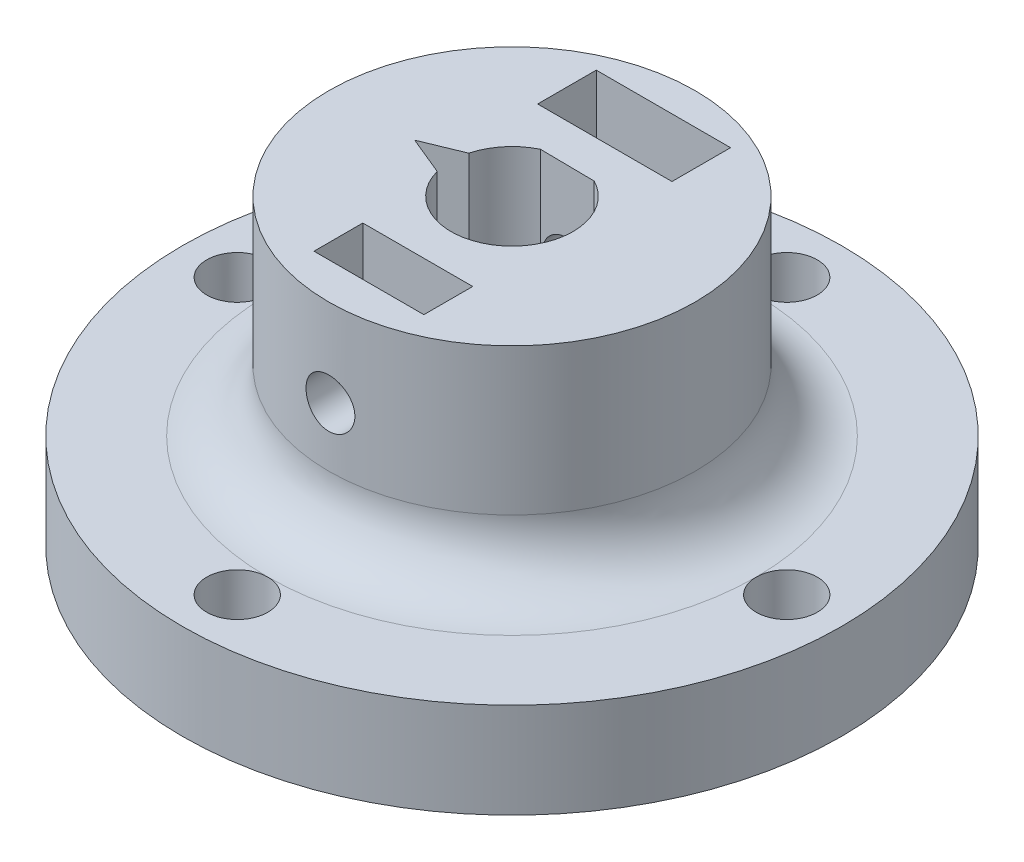
from build123d import *

# Parameters (mm, degrees)
SKETCH1_R               = 13.5
SKETCH1_R_2             = 1.25
BOSS_EXTRUDE2_DEPTH     = 2
SKETCH2_R               = 7.5
BOSS_EXTRUDE3_DEPTH     = 8.5
SKETCH4_R               = 2.5
CUT_EXTRUDE1_DEPTH      = 7.5
BOSS_EXTRUDE6_DEPTH     = 7.5
CUT_EXTRUDE2_DEPTH      = 7.5
CUT_EXTRUDE2_DEPTH_BACK = 11.75
SKETCH5_R               = 1
BOSS_EXTRUDE5_START     = 1.9
SKETCH7_R               = 13.5
SKETCH7_R_2             = 5.25
BOSS_EXTRUDE5_DEPTH     = 1.9
CUT_EXTRUDE3_DEPTH      = 8
FILLET1_R               = 2.5
SKETCH12_R              = 0.00537481
SKETCH12_R_2            = 0.008144056
SKETCH12_R_3            = 1.25
SKETCH12_R_4            = 0.012822725
CUT_EXTRUDE4_DEPTH      = 10
CIRPATTERN1_COUNT       = 4
SKETCH13_W              = 5.5
SKETCH13_H              = 2.4
SKETCH13_W_2            = 4.5
SKETCH13_H_2            = 2
CUT_EXTRUDE5_DEPTH      = 4
CUT_EXTRUDE6_DEPTH      = 2.4
CUT_EXTRUDE7_DEPTH      = 2


with BuildPart() as part:
    # Sketch1 → Boss-Extrude2 (new body)
    with BuildSketch(Plane(origin=(0, 0, 0), x_dir=(1, 0, 0), z_dir=(0, 1, 0))):
        with Locations(Location((0, 0, 0), (0, 0, 270))):
            Circle(SKETCH1_R)
        with Locations(Location((11.25, 0, 0), (0, 0, 270))):
            Circle(SKETCH1_R_2, mode=Mode.SUBTRACT)
        with Locations(Location((0, -11.25, 0), (0, 0, 270))):
            Circle(SKETCH1_R_2, mode=Mode.SUBTRACT)
        with Locations(Location((-11.25, 0, 0), (0, 0, 270))):
            Circle(SKETCH1_R_2, mode=Mode.SUBTRACT)
        with Locations(Location((0, 11.25, 0), (0, 0, 270))):
            Circle(SKETCH1_R_2, mode=Mode.SUBTRACT)
    extrude(amount=BOSS_EXTRUDE2_DEPTH)

    # Sketch2 → Boss-Extrude3 (add)
    with BuildSketch(Plane(origin=(0, 2, 0), x_dir=(1, 0, 0), z_dir=(0, 1, 0))):
        with Locations(Location((0, 0, 0), (0, 0, 270))):
            Circle(SKETCH2_R)
    extrude(amount=BOSS_EXTRUDE3_DEPTH)

    # Sketch4 → Cut-Extrude1 (cut)
    with BuildSketch(Plane(origin=(0, 10.5, 0), x_dir=(1, 0, 0), z_dir=(0, 1, 0))):
        with Locations(Location((0, 0, 0), (0, 0, 270))):
            Circle(SKETCH4_R)
    extrude(amount=-CUT_EXTRUDE1_DEPTH, mode=Mode.SUBTRACT)

    # Sketch16 → Boss-Extrude6 (add)
    with BuildSketch(Plane(origin=(0, 10.5, 0), x_dir=(1, 0, 0), z_dir=(0, 1, 0))):
        with BuildLine():
            Line((-1.086066966, 2.251767871), (1.141386704, 2.224238385))
            ThreePointArc((1.141386704, 2.224238385), (0.030895574, 2.499809085), (-1.086066966, 2.251767871))
        make_face()
    extrude(amount=-BOSS_EXTRUDE6_DEPTH)

    # Sketch5 → Cut-Extrude2 (cut, two sides: drawn at the far end of the back side and taken through both)
    with BuildSketch(Plane.XY.offset(-CUT_EXTRUDE2_DEPTH_BACK)):
        with Locations(Location((0, 6.914506731, 0), (0, 0, 180))):
            Circle(SKETCH5_R)
    extrude(amount=CUT_EXTRUDE2_DEPTH + CUT_EXTRUDE2_DEPTH_BACK, mode=Mode.SUBTRACT)

    # Sketch7 → Boss-Extrude5 (add)
    with BuildSketch(Plane.XZ.offset(BOSS_EXTRUDE5_START)):
        with Locations(Location((0, 0, 0), (0, 0, 270))):
            Circle(SKETCH7_R)
        with Locations(Location((0, 0, 0), (0, 0, 90))):
            Circle(SKETCH7_R_2, mode=Mode.SUBTRACT)
    extrude(amount=-BOSS_EXTRUDE5_DEPTH)

    # Sketch9 → Cut-Extrude3 (cut)
    with BuildSketch(Plane(origin=(0, 10.5, 0), x_dir=(1, 0, 0), z_dir=(0, 1, 0))):
        Polygon((-2.414753661, -0.64727487), (-2.414753661, 0.64727487), (-3.984419716, 0), align=None)
    extrude(amount=-CUT_EXTRUDE3_DEPTH, mode=Mode.SUBTRACT)

    # Fillet1
    fillet1_edges = [part.edges().sort_by_distance(p)[0] for p in [
        (0, 2, -7.5),
    ]]
    fillet(fillet1_edges, radius=FILLET1_R - 0.0001)  # a hair under: the kernel refuses the full size

    # Sketch12 → Cut-Extrude4 (cut)
    with BuildSketch(Plane(origin=(0, 0, 0), x_dir=(1, 0, 0), z_dir=(0, 1, 0))):
        with Locations(Location((-0.239113034, -10.028559531, 0), (0, 0, 101.087404696))):
            Circle(SKETCH12_R)
        with Locations(Location((-1.014615915, 11.966073133, 0), (0, 0, 144.78716899))):
            Circle(SKETCH12_R_2)
        with Locations(Location((-11, 0, 0), (0, 0, 264.260829523))):
            Circle(SKETCH12_R_3)
        with Locations(Location((10.492985163, 0.978537759, 0), (0, 0, 127.726196418))):
            Circle(SKETCH12_R_4)
    cut_extrude4 = extrude(amount=-CUT_EXTRUDE4_DEPTH, mode=Mode.SUBTRACT)

    # CirPattern1: Cut-Extrude4 ×4 about axis
    cirpattern1_axis = Axis((0, 0, 0), (0, 1, 0))
    for i in range(1, CIRPATTERN1_COUNT):
        add(cut_extrude4.rotate(cirpattern1_axis, i * 360 / CIRPATTERN1_COUNT), mode=Mode.SUBTRACT)

    # Sketch13 → Cut-Extrude5 (cut)
    with BuildSketch(Plane(origin=(0, 10.5, 0), x_dir=(1, 0, 0), z_dir=(0, 1, 0))):
        with Locations((0, 5)):
            Rectangle(SKETCH13_W, SKETCH13_H)
        with Locations((0.141735204, -5)):
            Rectangle(SKETCH13_W_2, SKETCH13_H_2)
    extrude(amount=-CUT_EXTRUDE5_DEPTH, mode=Mode.SUBTRACT)

    # Sketch14 → Cut-Extrude6 (cut)
    with BuildSketch(Plane(origin=(0, 0, -3.8), x_dir=(-1, 0, 0), z_dir=(0, 0, -1))):
        Polygon((2.721817224, 8.550063007), (-0.055524673, 10.089447729), (-2.777341897, 8.453891453), (-2.721817224, 5.278950455), (0.055524673, 3.739565732), (2.777341897, 5.375122009), align=None)
    extrude(amount=CUT_EXTRUDE6_DEPTH, mode=Mode.SUBTRACT)

    # Sketch15 → Cut-Extrude7 (cut)
    with BuildSketch(Plane.XY.offset(4)):
        Polygon((2.25, 8.213544837), (0, 9.512582942), (-2.25, 8.213544837), (-2.25, 5.615468625), (0, 4.31643052), (2.25, 5.615468625), align=None)
    extrude(amount=CUT_EXTRUDE7_DEPTH, mode=Mode.SUBTRACT)


solid = part.part
